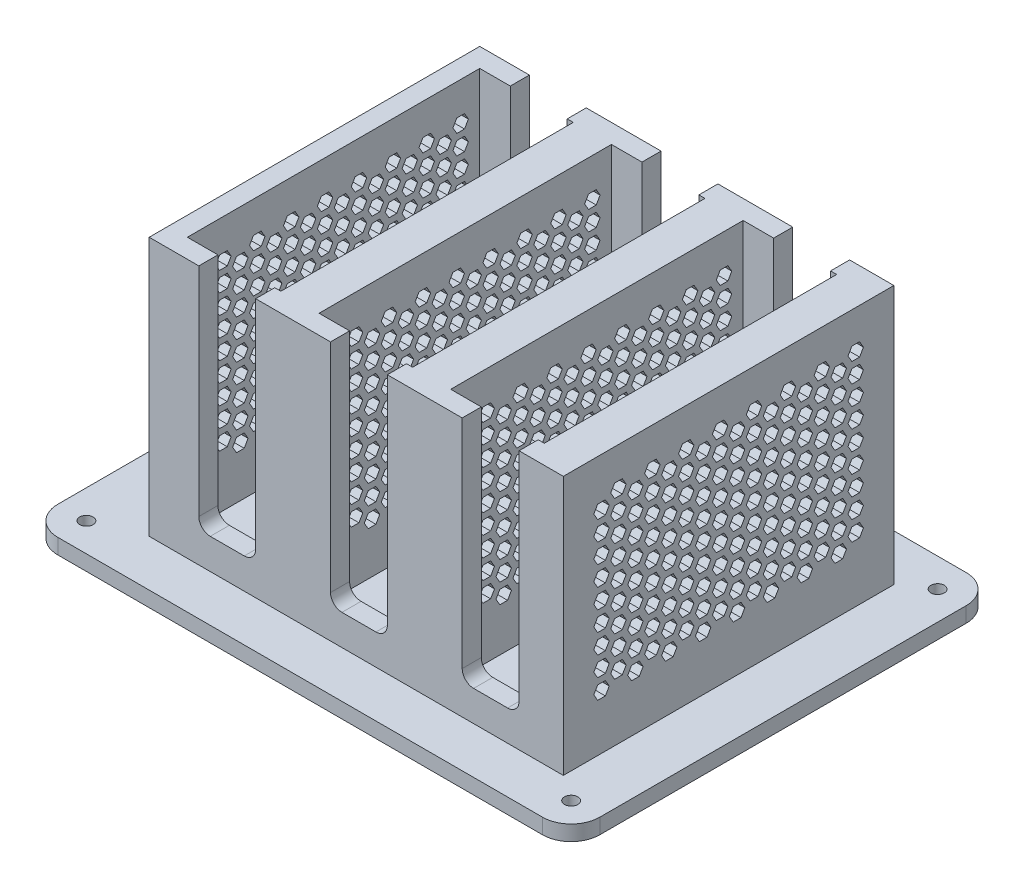
from build123d import *

# Parameters (mm, degrees)
SKETCH1_R           = 1.75
BOSS_EXTRUDE1_DEPTH = 4
BOSS_EXTRUDE3_DEPTH = 67.86200042
SKETCH6_W           = 108.5
SKETCH6_H           = 86.6
SKETCH6_W_2         = 93.5
SKETCH6_H_2         = 76.6
BOSS_EXTRUDE4_DEPTH = 8
FILLET1_R           = 3
SKETCH7_W           = 22.5
SKETCH7_H           = 76.6
BOSS_EXTRUDE5_DEPTH = 1.1360177
CUT_EXTRUDE1_DEPTH  = 153.682545186


with BuildPart() as part:
    # Sketch1 → Boss-Extrude1 (new body)
    with BuildSketch(Plane(origin=(0, 0, 0), x_dir=(1, 0, 0), z_dir=(0, 1, 0))):
        with BuildLine():
            Line((-63.5, -55.5), (63.5, -55.5))
            ThreePointArc((63.5, -55.5), (68.803300859, -53.303300859), (71, -48))
            Line((71, -48), (71, 48))
            ThreePointArc((71, 48), (68.803300859, 53.303300859), (63.5, 55.5))
            Line((63.5, 55.5), (-63.5, 55.5))
            ThreePointArc((-63.5, 55.5), (-68.803300859, 53.303300859), (-71, 48))
            Line((-71, 48), (-71, -48))
            ThreePointArc((-71, -48), (-68.803300859, -53.303300859), (-63.5, -55.5))
        make_face()
        with Locations(Location((-63.5, 48, 0), (0, 0, 270))):
            Circle(SKETCH1_R, mode=Mode.SUBTRACT)
        with Locations(Location((-63.5, -48, 0), (0, 0, 90))):
            Circle(SKETCH1_R, mode=Mode.SUBTRACT)
        with Locations(Location((63.5, 48, 0), (0, 0, 90))):
            Circle(SKETCH1_R, mode=Mode.SUBTRACT)
        with Locations(Location((63.5, -48, 0), (0, 0, 270))):
            Circle(SKETCH1_R, mode=Mode.SUBTRACT)
    extrude(amount=BOSS_EXTRUDE1_DEPTH)

    # Sketch5 → Boss-Extrude3 (add)
    with BuildSketch(Plane(origin=(0, 4, 0), x_dir=(1, 0, 0), z_dir=(0, 1, 0))):
        Polygon((-46.75, -38.3), (-46.75, 38.3), (-38.75, 38.3), (-38.75, 43.3), (-51.75, 43.3), (-51.75, -43.3), (-38.75, -43.3), (-38.75, -38.3), align=None)
        Polygon((-4.25, 43.3), (-4.25, 38.3), (-12.25, 38.3), (-12.25, -38.3), (-4.25, -38.3), (-4.25, -43.3), (-23.85, -43.3), (-23.85, -38.3), (-22.25, -38.3), (-22.25, 38.3), (-23.85, 38.3), (-23.85, 43.3), align=None)
        Polygon((12.25, -38.3), (12.25, 38.3), (10.65, 38.3), (10.65, 43.3), (30.25, 43.3), (30.25, 38.3), (22.25, 38.3), (22.25, -38.3), (30.25, -38.3), (30.25, -43.3), (10.65, -43.3), (10.65, -38.3), align=None)
        Polygon((46.75, -38.3), (46.75, 38.3), (45.15, 38.3), (45.15, 43.3), (56.75, 43.3), (56.75, 38.3), (56.75, -38.3), (56.75, -43.3), (45.15, -43.3), (45.15, -38.3), align=None)
    extrude(amount=BOSS_EXTRUDE3_DEPTH)

    # Sketch6 → Boss-Extrude4 (add)
    with BuildSketch(Plane(origin=(0, 4, 0), x_dir=(1, 0, 0), z_dir=(0, 1, 0))):
        with Locations((2.5, 0)):
            Rectangle(SKETCH6_W, SKETCH6_H)
        Rectangle(SKETCH6_W_2, SKETCH6_H_2, mode=Mode.SUBTRACT)
    extrude(amount=BOSS_EXTRUDE4_DEPTH)

    # Fillet1
    fillet1_edges = [part.edges().sort_by_distance(p)[0] for p in [
        (-38.75, 12, -40.8),
        (-23.85, 12, -40.8),
        (-38.75, 12, 40.8),
        (-23.85, 12, 40.8),
        (-4.25, 12, -40.8),
        (10.65, 12, -40.8),
        (-4.25, 12, 40.8),
        (10.65, 12, 40.8),
        (30.25, 12, -40.8),
        (45.15, 12, -40.8),
        (30.25, 12, 40.8),
        (45.15, 12, 40.8),
    ]]
    fillet(fillet1_edges, radius=FILLET1_R)

    # Sketch7 → Boss-Extrude5 (add)
    with BuildSketch(Plane(origin=(0, 4, 0), x_dir=(1, 0, 0), z_dir=(0, 1, 0))):
        with Locations((-35.5, 0)):
            Rectangle(SKETCH7_W, SKETCH7_H)
        with Locations((-1, 0)):
            Rectangle(SKETCH7_W, SKETCH7_H)
        with Locations((33.5, 0)):
            Rectangle(SKETCH7_W, SKETCH7_H)
    extrude(amount=BOSS_EXTRUDE5_DEPTH)

    # Sketch8 → Cut-Extrude1 (cut, through all)
    with BuildSketch(Plane.ZY.offset(51.75)):
        Polygon((-31.279274058, 61.86200042), (-32.289637029, 63.61200042), (-34.310362971, 63.61200042), (-35.320725942, 61.86200042), (-34.310362971, 60.11200042), (-32.289637029, 60.11200042), align=None)
        Polygon((-22.399274058, 61.86200042), (-23.409637029, 63.61200042), (-25.430362971, 63.61200042), (-26.440725942, 61.86200042), (-25.430362971, 60.11200042), (-23.409637029, 60.11200042), align=None)
        Polygon((-13.519274058, 61.86200042), (-14.529637029, 63.61200042), (-16.550362971, 63.61200042), (-17.560725942, 61.86200042), (-16.550362971, 60.11200042), (-14.529637029, 60.11200042), align=None)
        Polygon((-4.639274058, 61.86200042), (-5.649637029, 63.61200042), (-7.670362971, 63.61200042), (-8.680725942, 61.86200042), (-7.670362971, 60.11200042), (-5.649637029, 60.11200042), align=None)
        Polygon((4.240725942, 61.86200042), (3.230362971, 63.61200042), (1.209637029, 63.61200042), (0.199274058, 61.86200042), (1.209637029, 60.11200042), (3.230362971, 60.11200042), align=None)
        Polygon((13.120725942, 61.86200042), (12.110362971, 63.61200042), (10.089637029, 63.61200042), (9.079274058, 61.86200042), (10.089637029, 60.11200042), (12.110362971, 60.11200042), align=None)
        Polygon((22.000725942, 61.86200042), (20.990362971, 63.61200042), (18.969637029, 63.61200042), (17.959274058, 61.86200042), (18.969637029, 60.11200042), (20.990362971, 60.11200042), align=None)
        Polygon((30.880725942, 61.86200042), (29.870362971, 63.61200042), (27.849637029, 63.61200042), (26.839274058, 61.86200042), (27.849637029, 60.11200042), (29.870362971, 60.11200042), align=None)
        Polygon((-26.839274058, 59.298565225), (-27.849637029, 61.048565225), (-29.870362971, 61.048565225), (-30.880725942, 59.298565225), (-29.870362971, 57.548565225), (-27.849637029, 57.548565225), align=None)
        Polygon((-17.959274058, 59.298565225), (-18.969637029, 61.048565225), (-20.990362971, 61.048565225), (-22.000725942, 59.298565225), (-20.990362971, 57.548565225), (-18.969637029, 57.548565225), align=None)
        Polygon((-9.079274058, 59.298565225), (-10.089637029, 61.048565225), (-12.110362971, 61.048565225), (-13.120725942, 59.298565225), (-12.110362971, 57.548565225), (-10.089637029, 57.548565225), align=None)
        Polygon((-0.199274058, 59.298565225), (-1.209637029, 61.048565225), (-3.230362971, 61.048565225), (-4.240725942, 59.298565225), (-3.230362971, 57.548565225), (-1.209637029, 57.548565225), align=None)
        Polygon((8.680725942, 59.298565225), (7.670362971, 61.048565225), (5.649637029, 61.048565225), (4.639274058, 59.298565225), (5.649637029, 57.548565225), (7.670362971, 57.548565225), align=None)
        Polygon((17.560725942, 59.298565225), (16.550362971, 61.048565225), (14.529637029, 61.048565225), (13.519274058, 59.298565225), (14.529637029, 57.548565225), (16.550362971, 57.548565225), align=None)
        Polygon((26.440725942, 59.298565225), (25.430362971, 61.048565225), (23.409637029, 61.048565225), (22.399274058, 59.298565225), (23.409637029, 57.548565225), (25.430362971, 57.548565225), align=None)
        Polygon((35.320725942, 59.298565225), (34.310362971, 61.048565225), (32.289637029, 61.048565225), (31.279274058, 59.298565225), (32.289637029, 57.548565225), (34.310362971, 57.548565225), align=None)
        Polygon((-31.279274058, 56.73513003), (-32.289637029, 58.48513003), (-34.310362971, 58.48513003), (-35.320725942, 56.73513003), (-34.310362971, 54.98513003), (-32.289637029, 54.98513003), align=None)
        Polygon((-22.399274058, 56.73513003), (-23.409637029, 58.48513003), (-25.430362971, 58.48513003), (-26.440725942, 56.73513003), (-25.430362971, 54.98513003), (-23.409637029, 54.98513003), align=None)
        Polygon((-13.519274058, 56.73513003), (-14.529637029, 58.48513003), (-16.550362971, 58.48513003), (-17.560725942, 56.73513003), (-16.550362971, 54.98513003), (-14.529637029, 54.98513003), align=None)
        Polygon((-4.639274058, 56.73513003), (-5.649637029, 58.48513003), (-7.670362971, 58.48513003), (-8.680725942, 56.73513003), (-7.670362971, 54.98513003), (-5.649637029, 54.98513003), align=None)
        Polygon((4.240725942, 56.73513003), (3.230362971, 58.48513003), (1.209637029, 58.48513003), (0.199274058, 56.73513003), (1.209637029, 54.98513003), (3.230362971, 54.98513003), align=None)
        Polygon((13.120725942, 56.73513003), (12.110362971, 58.48513003), (10.089637029, 58.48513003), (9.079274058, 56.73513003), (10.089637029, 54.98513003), (12.110362971, 54.98513003), align=None)
        Polygon((22.000725942, 56.73513003), (20.990362971, 58.48513003), (18.969637029, 58.48513003), (17.959274058, 56.73513003), (18.969637029, 54.98513003), (20.990362971, 54.98513003), align=None)
        Polygon((30.880725942, 56.73513003), (29.870362971, 58.48513003), (27.849637029, 58.48513003), (26.839274058, 56.73513003), (27.849637029, 54.98513003), (29.870362971, 54.98513003), align=None)
        Polygon((-26.839274058, 54.171694834), (-27.849637029, 55.921694834), (-29.870362971, 55.921694834), (-30.880725942, 54.171694834), (-29.870362971, 52.421694834), (-27.849637029, 52.421694834), align=None)
        Polygon((-17.959274058, 54.171694834), (-18.969637029, 55.921694834), (-20.990362971, 55.921694834), (-22.000725942, 54.171694834), (-20.990362971, 52.421694834), (-18.969637029, 52.421694834), align=None)
        Polygon((-9.079274058, 54.171694834), (-10.089637029, 55.921694834), (-12.110362971, 55.921694834), (-13.120725942, 54.171694834), (-12.110362971, 52.421694834), (-10.089637029, 52.421694834), align=None)
        Polygon((-0.199274058, 54.171694834), (-1.209637029, 55.921694834), (-3.230362971, 55.921694834), (-4.240725942, 54.171694834), (-3.230362971, 52.421694834), (-1.209637029, 52.421694834), align=None)
        Polygon((8.680725942, 54.171694834), (7.670362971, 55.921694834), (5.649637029, 55.921694834), (4.639274058, 54.171694834), (5.649637029, 52.421694834), (7.670362971, 52.421694834), align=None)
        Polygon((17.560725942, 54.171694834), (16.550362971, 55.921694834), (14.529637029, 55.921694834), (13.519274058, 54.171694834), (14.529637029, 52.421694834), (16.550362971, 52.421694834), align=None)
        Polygon((26.440725942, 54.171694834), (25.430362971, 55.921694834), (23.409637029, 55.921694834), (22.399274058, 54.171694834), (23.409637029, 52.421694834), (25.430362971, 52.421694834), align=None)
        Polygon((35.320725942, 54.171694834), (34.310362971, 55.921694834), (32.289637029, 55.921694834), (31.279274058, 54.171694834), (32.289637029, 52.421694834), (34.310362971, 52.421694834), align=None)
        Polygon((-31.279274058, 51.608259639), (-32.289637029, 53.358259639), (-34.310362971, 53.358259639), (-35.320725942, 51.608259639), (-34.310362971, 49.858259639), (-32.289637029, 49.858259639), align=None)
        Polygon((-22.399274058, 51.608259639), (-23.409637029, 53.358259639), (-25.430362971, 53.358259639), (-26.440725942, 51.608259639), (-25.430362971, 49.858259639), (-23.409637029, 49.858259639), align=None)
        Polygon((-13.519274058, 51.608259639), (-14.529637029, 53.358259639), (-16.550362971, 53.358259639), (-17.560725942, 51.608259639), (-16.550362971, 49.858259639), (-14.529637029, 49.858259639), align=None)
        Polygon((-4.639274058, 51.608259639), (-5.649637029, 53.358259639), (-7.670362971, 53.358259639), (-8.680725942, 51.608259639), (-7.670362971, 49.858259639), (-5.649637029, 49.858259639), align=None)
        Polygon((4.240725942, 51.608259639), (3.230362971, 53.358259639), (1.209637029, 53.358259639), (0.199274058, 51.608259639), (1.209637029, 49.858259639), (3.230362971, 49.858259639), align=None)
        Polygon((13.120725942, 51.608259639), (12.110362971, 53.358259639), (10.089637029, 53.358259639), (9.079274058, 51.608259639), (10.089637029, 49.858259639), (12.110362971, 49.858259639), align=None)
        Polygon((22.000725942, 51.608259639), (20.990362971, 53.358259639), (18.969637029, 53.358259639), (17.959274058, 51.608259639), (18.969637029, 49.858259639), (20.990362971, 49.858259639), align=None)
        Polygon((30.880725942, 51.608259639), (29.870362971, 53.358259639), (27.849637029, 53.358259639), (26.839274058, 51.608259639), (27.849637029, 49.858259639), (29.870362971, 49.858259639), align=None)
        Polygon((-26.839274058, 49.044824444), (-27.849637029, 50.794824444), (-29.870362971, 50.794824444), (-30.880725942, 49.044824444), (-29.870362971, 47.294824444), (-27.849637029, 47.294824444), align=None)
        Polygon((-17.959274058, 49.044824444), (-18.969637029, 50.794824444), (-20.990362971, 50.794824444), (-22.000725942, 49.044824444), (-20.990362971, 47.294824444), (-18.969637029, 47.294824444), align=None)
        Polygon((-9.079274058, 49.044824444), (-10.089637029, 50.794824444), (-12.110362971, 50.794824444), (-13.120725942, 49.044824444), (-12.110362971, 47.294824444), (-10.089637029, 47.294824444), align=None)
        Polygon((-0.199274058, 49.044824444), (-1.209637029, 50.794824444), (-3.230362971, 50.794824444), (-4.240725942, 49.044824444), (-3.230362971, 47.294824444), (-1.209637029, 47.294824444), align=None)
        Polygon((8.680725942, 49.044824444), (7.670362971, 50.794824444), (5.649637029, 50.794824444), (4.639274058, 49.044824444), (5.649637029, 47.294824444), (7.670362971, 47.294824444), align=None)
        Polygon((17.560725942, 49.044824444), (16.550362971, 50.794824444), (14.529637029, 50.794824444), (13.519274058, 49.044824444), (14.529637029, 47.294824444), (16.550362971, 47.294824444), align=None)
        Polygon((26.440725942, 49.044824444), (25.430362971, 50.794824444), (23.409637029, 50.794824444), (22.399274058, 49.044824444), (23.409637029, 47.294824444), (25.430362971, 47.294824444), align=None)
        Polygon((35.320725942, 49.044824444), (34.310362971, 50.794824444), (32.289637029, 50.794824444), (31.279274058, 49.044824444), (32.289637029, 47.294824444), (34.310362971, 47.294824444), align=None)
        Polygon((-31.279274058, 46.481389249), (-32.289637029, 48.231389249), (-34.310362971, 48.231389249), (-35.320725942, 46.481389249), (-34.310362971, 44.731389249), (-32.289637029, 44.731389249), align=None)
        Polygon((-22.399274058, 46.481389249), (-23.409637029, 48.231389249), (-25.430362971, 48.231389249), (-26.440725942, 46.481389249), (-25.430362971, 44.731389249), (-23.409637029, 44.731389249), align=None)
        Polygon((-13.519274058, 46.481389249), (-14.529637029, 48.231389249), (-16.550362971, 48.231389249), (-17.560725942, 46.481389249), (-16.550362971, 44.731389249), (-14.529637029, 44.731389249), align=None)
        Polygon((-4.639274058, 46.481389249), (-5.649637029, 48.231389249), (-7.670362971, 48.231389249), (-8.680725942, 46.481389249), (-7.670362971, 44.731389249), (-5.649637029, 44.731389249), align=None)
        Polygon((4.240725942, 46.481389249), (3.230362971, 48.231389249), (1.209637029, 48.231389249), (0.199274058, 46.481389249), (1.209637029, 44.731389249), (3.230362971, 44.731389249), align=None)
        Polygon((13.120725942, 46.481389249), (12.110362971, 48.231389249), (10.089637029, 48.231389249), (9.079274058, 46.481389249), (10.089637029, 44.731389249), (12.110362971, 44.731389249), align=None)
        Polygon((22.000725942, 46.481389249), (20.990362971, 48.231389249), (18.969637029, 48.231389249), (17.959274058, 46.481389249), (18.969637029, 44.731389249), (20.990362971, 44.731389249), align=None)
        Polygon((30.880725942, 46.481389249), (29.870362971, 48.231389249), (27.849637029, 48.231389249), (26.839274058, 46.481389249), (27.849637029, 44.731389249), (29.870362971, 44.731389249), align=None)
        Polygon((-26.839274058, 43.917954054), (-27.849637029, 45.667954054), (-29.870362971, 45.667954054), (-30.880725942, 43.917954054), (-29.870362971, 42.167954054), (-27.849637029, 42.167954054), align=None)
        Polygon((-17.959274058, 43.917954054), (-18.969637029, 45.667954054), (-20.990362971, 45.667954054), (-22.000725942, 43.917954054), (-20.990362971, 42.167954054), (-18.969637029, 42.167954054), align=None)
        Polygon((-9.079274058, 43.917954054), (-10.089637029, 45.667954054), (-12.110362971, 45.667954054), (-13.120725942, 43.917954054), (-12.110362971, 42.167954054), (-10.089637029, 42.167954054), align=None)
        Polygon((-0.199274058, 43.917954054), (-1.209637029, 45.667954054), (-3.230362971, 45.667954054), (-4.240725942, 43.917954054), (-3.230362971, 42.167954054), (-1.209637029, 42.167954054), align=None)
        Polygon((8.680725942, 43.917954054), (7.670362971, 45.667954054), (5.649637029, 45.667954054), (4.639274058, 43.917954054), (5.649637029, 42.167954054), (7.670362971, 42.167954054), align=None)
        Polygon((17.560725942, 43.917954054), (16.550362971, 45.667954054), (14.529637029, 45.667954054), (13.519274058, 43.917954054), (14.529637029, 42.167954054), (16.550362971, 42.167954054), align=None)
        Polygon((26.440725942, 43.917954054), (25.430362971, 45.667954054), (23.409637029, 45.667954054), (22.399274058, 43.917954054), (23.409637029, 42.167954054), (25.430362971, 42.167954054), align=None)
        Polygon((35.320725942, 43.917954054), (34.310362971, 45.667954054), (32.289637029, 45.667954054), (31.279274058, 43.917954054), (32.289637029, 42.167954054), (34.310362971, 42.167954054), align=None)
        Polygon((-31.279274058, 41.354518858), (-32.289637029, 43.104518858), (-34.310362971, 43.104518858), (-35.320725942, 41.354518858), (-34.310362971, 39.604518858), (-32.289637029, 39.604518858), align=None)
        Polygon((-22.399274058, 41.354518858), (-23.409637029, 43.104518858), (-25.430362971, 43.104518858), (-26.440725942, 41.354518858), (-25.430362971, 39.604518858), (-23.409637029, 39.604518858), align=None)
        Polygon((-13.519274058, 41.354518858), (-14.529637029, 43.104518858), (-16.550362971, 43.104518858), (-17.560725942, 41.354518858), (-16.550362971, 39.604518858), (-14.529637029, 39.604518858), align=None)
        Polygon((-4.639274058, 41.354518858), (-5.649637029, 43.104518858), (-7.670362971, 43.104518858), (-8.680725942, 41.354518858), (-7.670362971, 39.604518858), (-5.649637029, 39.604518858), align=None)
        Polygon((4.240725942, 41.354518858), (3.230362971, 43.104518858), (1.209637029, 43.104518858), (0.199274058, 41.354518858), (1.209637029, 39.604518858), (3.230362971, 39.604518858), align=None)
        Polygon((13.120725942, 41.354518858), (12.110362971, 43.104518858), (10.089637029, 43.104518858), (9.079274058, 41.354518858), (10.089637029, 39.604518858), (12.110362971, 39.604518858), align=None)
        Polygon((22.000725942, 41.354518858), (20.990362971, 43.104518858), (18.969637029, 43.104518858), (17.959274058, 41.354518858), (18.969637029, 39.604518858), (20.990362971, 39.604518858), align=None)
        Polygon((30.880725942, 41.354518858), (29.870362971, 43.104518858), (27.849637029, 43.104518858), (26.839274058, 41.354518858), (27.849637029, 39.604518858), (29.870362971, 39.604518858), align=None)
        Polygon((-26.839274058, 38.791083663), (-27.849637029, 40.541083663), (-29.870362971, 40.541083663), (-30.880725942, 38.791083663), (-29.870362971, 37.041083663), (-27.849637029, 37.041083663), align=None)
        Polygon((-17.959274058, 38.791083663), (-18.969637029, 40.541083663), (-20.990362971, 40.541083663), (-22.000725942, 38.791083663), (-20.990362971, 37.041083663), (-18.969637029, 37.041083663), align=None)
        Polygon((-9.079274058, 38.791083663), (-10.089637029, 40.541083663), (-12.110362971, 40.541083663), (-13.120725942, 38.791083663), (-12.110362971, 37.041083663), (-10.089637029, 37.041083663), align=None)
        Polygon((-0.199274058, 38.791083663), (-1.209637029, 40.541083663), (-3.230362971, 40.541083663), (-4.240725942, 38.791083663), (-3.230362971, 37.041083663), (-1.209637029, 37.041083663), align=None)
        Polygon((8.680725942, 38.791083663), (7.670362971, 40.541083663), (5.649637029, 40.541083663), (4.639274058, 38.791083663), (5.649637029, 37.041083663), (7.670362971, 37.041083663), align=None)
        Polygon((17.560725942, 38.791083663), (16.550362971, 40.541083663), (14.529637029, 40.541083663), (13.519274058, 38.791083663), (14.529637029, 37.041083663), (16.550362971, 37.041083663), align=None)
        Polygon((26.440725942, 38.791083663), (25.430362971, 40.541083663), (23.409637029, 40.541083663), (22.399274058, 38.791083663), (23.409637029, 37.041083663), (25.430362971, 37.041083663), align=None)
        Polygon((35.320725942, 38.791083663), (34.310362971, 40.541083663), (32.289637029, 40.541083663), (31.279274058, 38.791083663), (32.289637029, 37.041083663), (34.310362971, 37.041083663), align=None)
        Polygon((-31.279274058, 36.227648468), (-32.289637029, 37.977648468), (-34.310362971, 37.977648468), (-35.320725942, 36.227648468), (-34.310362971, 34.477648468), (-32.289637029, 34.477648468), align=None)
        Polygon((-22.399274058, 36.227648468), (-23.409637029, 37.977648468), (-25.430362971, 37.977648468), (-26.440725942, 36.227648468), (-25.430362971, 34.477648468), (-23.409637029, 34.477648468), align=None)
        Polygon((-13.519274058, 36.227648468), (-14.529637029, 37.977648468), (-16.550362971, 37.977648468), (-17.560725942, 36.227648468), (-16.550362971, 34.477648468), (-14.529637029, 34.477648468), align=None)
        Polygon((-4.639274058, 36.227648468), (-5.649637029, 37.977648468), (-7.670362971, 37.977648468), (-8.680725942, 36.227648468), (-7.670362971, 34.477648468), (-5.649637029, 34.477648468), align=None)
        Polygon((4.240725942, 36.227648468), (3.230362971, 37.977648468), (1.209637029, 37.977648468), (0.199274058, 36.227648468), (1.209637029, 34.477648468), (3.230362971, 34.477648468), align=None)
        Polygon((13.120725942, 36.227648468), (12.110362971, 37.977648468), (10.089637029, 37.977648468), (9.079274058, 36.227648468), (10.089637029, 34.477648468), (12.110362971, 34.477648468), align=None)
        Polygon((22.000725942, 36.227648468), (20.990362971, 37.977648468), (18.969637029, 37.977648468), (17.959274058, 36.227648468), (18.969637029, 34.477648468), (20.990362971, 34.477648468), align=None)
        Polygon((30.880725942, 36.227648468), (29.870362971, 37.977648468), (27.849637029, 37.977648468), (26.839274058, 36.227648468), (27.849637029, 34.477648468), (29.870362971, 34.477648468), align=None)
        Polygon((-26.839274058, 33.664213273), (-27.849637029, 35.414213273), (-29.870362971, 35.414213273), (-30.880725942, 33.664213273), (-29.870362971, 31.914213273), (-27.849637029, 31.914213273), align=None)
        Polygon((-17.959274058, 33.664213273), (-18.969637029, 35.414213273), (-20.990362971, 35.414213273), (-22.000725942, 33.664213273), (-20.990362971, 31.914213273), (-18.969637029, 31.914213273), align=None)
        Polygon((-9.079274058, 33.664213273), (-10.089637029, 35.414213273), (-12.110362971, 35.414213273), (-13.120725942, 33.664213273), (-12.110362971, 31.914213273), (-10.089637029, 31.914213273), align=None)
        Polygon((-0.199274058, 33.664213273), (-1.209637029, 35.414213273), (-3.230362971, 35.414213273), (-4.240725942, 33.664213273), (-3.230362971, 31.914213273), (-1.209637029, 31.914213273), align=None)
        Polygon((8.680725942, 33.664213273), (7.670362971, 35.414213273), (5.649637029, 35.414213273), (4.639274058, 33.664213273), (5.649637029, 31.914213273), (7.670362971, 31.914213273), align=None)
        Polygon((17.560725942, 33.664213273), (16.550362971, 35.414213273), (14.529637029, 35.414213273), (13.519274058, 33.664213273), (14.529637029, 31.914213273), (16.550362971, 31.914213273), align=None)
        Polygon((26.440725942, 33.664213273), (25.430362971, 35.414213273), (23.409637029, 35.414213273), (22.399274058, 33.664213273), (23.409637029, 31.914213273), (25.430362971, 31.914213273), align=None)
        Polygon((35.320725942, 33.664213273), (34.310362971, 35.414213273), (32.289637029, 35.414213273), (31.279274058, 33.664213273), (32.289637029, 31.914213273), (34.310362971, 31.914213273), align=None)
        Polygon((-31.279274058, 31.100778078), (-32.289637029, 32.850778078), (-34.310362971, 32.850778078), (-35.320725942, 31.100778078), (-34.310362971, 29.350778078), (-32.289637029, 29.350778078), align=None)
        Polygon((-22.399274058, 31.100778078), (-23.409637029, 32.850778078), (-25.430362971, 32.850778078), (-26.440725942, 31.100778078), (-25.430362971, 29.350778078), (-23.409637029, 29.350778078), align=None)
        Polygon((-13.519274058, 31.100778078), (-14.529637029, 32.850778078), (-16.550362971, 32.850778078), (-17.560725942, 31.100778078), (-16.550362971, 29.350778078), (-14.529637029, 29.350778078), align=None)
        Polygon((-4.639274058, 31.100778078), (-5.649637029, 32.850778078), (-7.670362971, 32.850778078), (-8.680725942, 31.100778078), (-7.670362971, 29.350778078), (-5.649637029, 29.350778078), align=None)
        Polygon((4.240725942, 31.100778078), (3.230362971, 32.850778078), (1.209637029, 32.850778078), (0.199274058, 31.100778078), (1.209637029, 29.350778078), (3.230362971, 29.350778078), align=None)
        Polygon((13.120725942, 31.100778078), (12.110362971, 32.850778078), (10.089637029, 32.850778078), (9.079274058, 31.100778078), (10.089637029, 29.350778078), (12.110362971, 29.350778078), align=None)
        Polygon((22.000725942, 31.100778078), (20.990362971, 32.850778078), (18.969637029, 32.850778078), (17.959274058, 31.100778078), (18.969637029, 29.350778078), (20.990362971, 29.350778078), align=None)
        Polygon((30.880725942, 31.100778078), (29.870362971, 32.850778078), (27.849637029, 32.850778078), (26.839274058, 31.100778078), (27.849637029, 29.350778078), (29.870362971, 29.350778078), align=None)
        Polygon((-26.839274058, 28.537342882), (-27.849637029, 30.287342882), (-29.870362971, 30.287342882), (-30.880725942, 28.537342882), (-29.870362971, 26.787342882), (-27.849637029, 26.787342882), align=None)
        Polygon((-17.959274058, 28.537342882), (-18.969637029, 30.287342882), (-20.990362971, 30.287342882), (-22.000725942, 28.537342882), (-20.990362971, 26.787342882), (-18.969637029, 26.787342882), align=None)
        Polygon((-9.079274058, 28.537342882), (-10.089637029, 30.287342882), (-12.110362971, 30.287342882), (-13.120725942, 28.537342882), (-12.110362971, 26.787342882), (-10.089637029, 26.787342882), align=None)
        Polygon((-0.199274058, 28.537342882), (-1.209637029, 30.287342882), (-3.230362971, 30.287342882), (-4.240725942, 28.537342882), (-3.230362971, 26.787342882), (-1.209637029, 26.787342882), align=None)
        Polygon((8.680725942, 28.537342882), (7.670362971, 30.287342882), (5.649637029, 30.287342882), (4.639274058, 28.537342882), (5.649637029, 26.787342882), (7.670362971, 26.787342882), align=None)
        Polygon((17.560725942, 28.537342882), (16.550362971, 30.287342882), (14.529637029, 30.287342882), (13.519274058, 28.537342882), (14.529637029, 26.787342882), (16.550362971, 26.787342882), align=None)
        Polygon((26.440725942, 28.537342882), (25.430362971, 30.287342882), (23.409637029, 30.287342882), (22.399274058, 28.537342882), (23.409637029, 26.787342882), (25.430362971, 26.787342882), align=None)
        Polygon((35.320725942, 28.537342882), (34.310362971, 30.287342882), (32.289637029, 30.287342882), (31.279274058, 28.537342882), (32.289637029, 26.787342882), (34.310362971, 26.787342882), align=None)
        Polygon((-31.279274058, 25.973907687), (-32.289637029, 27.723907687), (-34.310362971, 27.723907687), (-35.320725942, 25.973907687), (-34.310362971, 24.223907687), (-32.289637029, 24.223907687), align=None)
        Polygon((-22.399274058, 25.973907687), (-23.409637029, 27.723907687), (-25.430362971, 27.723907687), (-26.440725942, 25.973907687), (-25.430362971, 24.223907687), (-23.409637029, 24.223907687), align=None)
        Polygon((-13.519274058, 25.973907687), (-14.529637029, 27.723907687), (-16.550362971, 27.723907687), (-17.560725942, 25.973907687), (-16.550362971, 24.223907687), (-14.529637029, 24.223907687), align=None)
        Polygon((-4.639274058, 25.973907687), (-5.649637029, 27.723907687), (-7.670362971, 27.723907687), (-8.680725942, 25.973907687), (-7.670362971, 24.223907687), (-5.649637029, 24.223907687), align=None)
        Polygon((4.240725942, 25.973907687), (3.230362971, 27.723907687), (1.209637029, 27.723907687), (0.199274058, 25.973907687), (1.209637029, 24.223907687), (3.230362971, 24.223907687), align=None)
        Polygon((13.120725942, 25.973907687), (12.110362971, 27.723907687), (10.089637029, 27.723907687), (9.079274058, 25.973907687), (10.089637029, 24.223907687), (12.110362971, 24.223907687), align=None)
        Polygon((22.000725942, 25.973907687), (20.990362971, 27.723907687), (18.969637029, 27.723907687), (17.959274058, 25.973907687), (18.969637029, 24.223907687), (20.990362971, 24.223907687), align=None)
        Polygon((30.880725942, 25.973907687), (29.870362971, 27.723907687), (27.849637029, 27.723907687), (26.839274058, 25.973907687), (27.849637029, 24.223907687), (29.870362971, 24.223907687), align=None)
        Polygon((-26.839274058, 23.410472492), (-27.849637029, 25.160472492), (-29.870362971, 25.160472492), (-30.880725942, 23.410472492), (-29.870362971, 21.660472492), (-27.849637029, 21.660472492), align=None)
        Polygon((-17.959274058, 23.410472492), (-18.969637029, 25.160472492), (-20.990362971, 25.160472492), (-22.000725942, 23.410472492), (-20.990362971, 21.660472492), (-18.969637029, 21.660472492), align=None)
        Polygon((-9.079274058, 23.410472492), (-10.089637029, 25.160472492), (-12.110362971, 25.160472492), (-13.120725942, 23.410472492), (-12.110362971, 21.660472492), (-10.089637029, 21.660472492), align=None)
        Polygon((-0.199274058, 23.410472492), (-1.209637029, 25.160472492), (-3.230362971, 25.160472492), (-4.240725942, 23.410472492), (-3.230362971, 21.660472492), (-1.209637029, 21.660472492), align=None)
        Polygon((8.680725942, 23.410472492), (7.670362971, 25.160472492), (5.649637029, 25.160472492), (4.639274058, 23.410472492), (5.649637029, 21.660472492), (7.670362971, 21.660472492), align=None)
        Polygon((17.560725942, 23.410472492), (16.550362971, 25.160472492), (14.529637029, 25.160472492), (13.519274058, 23.410472492), (14.529637029, 21.660472492), (16.550362971, 21.660472492), align=None)
        Polygon((26.440725942, 23.410472492), (25.430362971, 25.160472492), (23.409637029, 25.160472492), (22.399274058, 23.410472492), (23.409637029, 21.660472492), (25.430362971, 21.660472492), align=None)
        Polygon((35.320725942, 23.410472492), (34.310362971, 25.160472492), (32.289637029, 25.160472492), (31.279274058, 23.410472492), (32.289637029, 21.660472492), (34.310362971, 21.660472492), align=None)
        Polygon((-31.279274058, 20.847037297), (-32.289637029, 22.597037297), (-34.310362971, 22.597037297), (-35.320725942, 20.847037297), (-34.310362971, 19.097037297), (-32.289637029, 19.097037297), align=None)
        Polygon((-22.399274058, 20.847037297), (-23.409637029, 22.597037297), (-25.430362971, 22.597037297), (-26.440725942, 20.847037297), (-25.430362971, 19.097037297), (-23.409637029, 19.097037297), align=None)
        Polygon((-13.519274058, 20.847037297), (-14.529637029, 22.597037297), (-16.550362971, 22.597037297), (-17.560725942, 20.847037297), (-16.550362971, 19.097037297), (-14.529637029, 19.097037297), align=None)
        Polygon((-4.639274058, 20.847037297), (-5.649637029, 22.597037297), (-7.670362971, 22.597037297), (-8.680725942, 20.847037297), (-7.670362971, 19.097037297), (-5.649637029, 19.097037297), align=None)
        Polygon((4.240725942, 20.847037297), (3.230362971, 22.597037297), (1.209637029, 22.597037297), (0.199274058, 20.847037297), (1.209637029, 19.097037297), (3.230362971, 19.097037297), align=None)
        Polygon((13.120725942, 20.847037297), (12.110362971, 22.597037297), (10.089637029, 22.597037297), (9.079274058, 20.847037297), (10.089637029, 19.097037297), (12.110362971, 19.097037297), align=None)
        Polygon((22.000725942, 20.847037297), (20.990362971, 22.597037297), (18.969637029, 22.597037297), (17.959274058, 20.847037297), (18.969637029, 19.097037297), (20.990362971, 19.097037297), align=None)
        Polygon((30.880725942, 20.847037297), (29.870362971, 22.597037297), (27.849637029, 22.597037297), (26.839274058, 20.847037297), (27.849637029, 19.097037297), (29.870362971, 19.097037297), align=None)
        Polygon((-26.839274058, 18.283602102), (-27.849637029, 20.033602102), (-29.870362971, 20.033602102), (-30.880725942, 18.283602102), (-29.870362971, 16.533602102), (-27.849637029, 16.533602102), align=None)
        Polygon((-17.959274058, 18.283602102), (-18.969637029, 20.033602102), (-20.990362971, 20.033602102), (-22.000725942, 18.283602102), (-20.990362971, 16.533602102), (-18.969637029, 16.533602102), align=None)
        Polygon((-9.079274058, 18.283602102), (-10.089637029, 20.033602102), (-12.110362971, 20.033602102), (-13.120725942, 18.283602102), (-12.110362971, 16.533602102), (-10.089637029, 16.533602102), align=None)
        Polygon((-0.199274058, 18.283602102), (-1.209637029, 20.033602102), (-3.230362971, 20.033602102), (-4.240725942, 18.283602102), (-3.230362971, 16.533602102), (-1.209637029, 16.533602102), align=None)
        Polygon((8.680725942, 18.283602102), (7.670362971, 20.033602102), (5.649637029, 20.033602102), (4.639274058, 18.283602102), (5.649637029, 16.533602102), (7.670362971, 16.533602102), align=None)
        Polygon((17.560725942, 18.283602102), (16.550362971, 20.033602102), (14.529637029, 20.033602102), (13.519274058, 18.283602102), (14.529637029, 16.533602102), (16.550362971, 16.533602102), align=None)
        Polygon((26.440725942, 18.283602102), (25.430362971, 20.033602102), (23.409637029, 20.033602102), (22.399274058, 18.283602102), (23.409637029, 16.533602102), (25.430362971, 16.533602102), align=None)
        Polygon((35.320725942, 18.283602102), (34.310362971, 20.033602102), (32.289637029, 20.033602102), (31.279274058, 18.283602102), (32.289637029, 16.533602102), (34.310362971, 16.533602102), align=None)
    extrude(amount=-CUT_EXTRUDE1_DEPTH, mode=Mode.SUBTRACT)


solid = part.part
